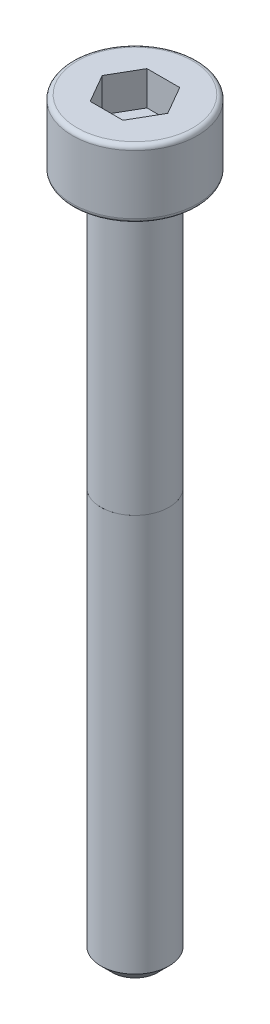
from build123d import *

# Parameters (mm, degrees)
SKETCH1_R           = 2.75
BOSS_EXTRUDE1_DEPTH = 3
CUT_EXTRUDE1_DEPTH  = 1.5
SKETCH3_R           = 1.5
BOSS_EXTRUDE2_DEPTH = 12
SKETCH4_R           = 1.5
BOSS_EXTRUDE3_DEPTH = 18
CHAMFER1_SIZE       = 0.5
FILLET1_R           = 0.2


with BuildPart() as part:
    # Sketch1 → Boss-Extrude1 (new body)
    with BuildSketch(Plane(origin=(0, 0, 0), x_dir=(1, 0, 0), z_dir=(0, 1, 0))):
        Circle(SKETCH1_R)
    extrude(amount=-BOSS_EXTRUDE1_DEPTH)

    # Sketch2 → Cut-Extrude1 (cut)
    with BuildSketch(Plane(origin=(0, 0, 0), x_dir=(1, 0, 0), z_dir=(0, 1, 0))):
        Polygon((1.443375673, 0), (0.721687836, 1.25), (-0.721687836, 1.25), (-1.443375673, 0), (-0.721687836, -1.25), (0.721687836, -1.25), align=None)
    extrude(amount=-CUT_EXTRUDE1_DEPTH, mode=Mode.SUBTRACT)

    # Sketch3 → Boss-Extrude2 (add)
    with BuildSketch(Plane.XZ.offset(3)):
        Circle(SKETCH3_R)
    extrude(amount=BOSS_EXTRUDE2_DEPTH)

    # Fillet1
    fillet1_edges = [part.edges().sort_by_distance(p)[0] for p in [
        (-2.75, -3, 0),
        (-2.75, 0, 0),
    ]]
    fillet(fillet1_edges, radius=FILLET1_R)


with BuildPart() as body_2:
    # Sketch4 → Boss-Extrude3 (new body)
    with BuildSketch(Plane.XZ.offset(15)):
        Circle(SKETCH4_R)
    extrude(amount=BOSS_EXTRUDE3_DEPTH)

    # Chamfer1
    chamfer1_edges = [body_2.edges().sort_by_distance(p)[0] for p in [
        (-1.5, -33, 0),
    ]]
    chamfer(chamfer1_edges, length=CHAMFER1_SIZE)


solid = Compound([part.part, body_2.part])
